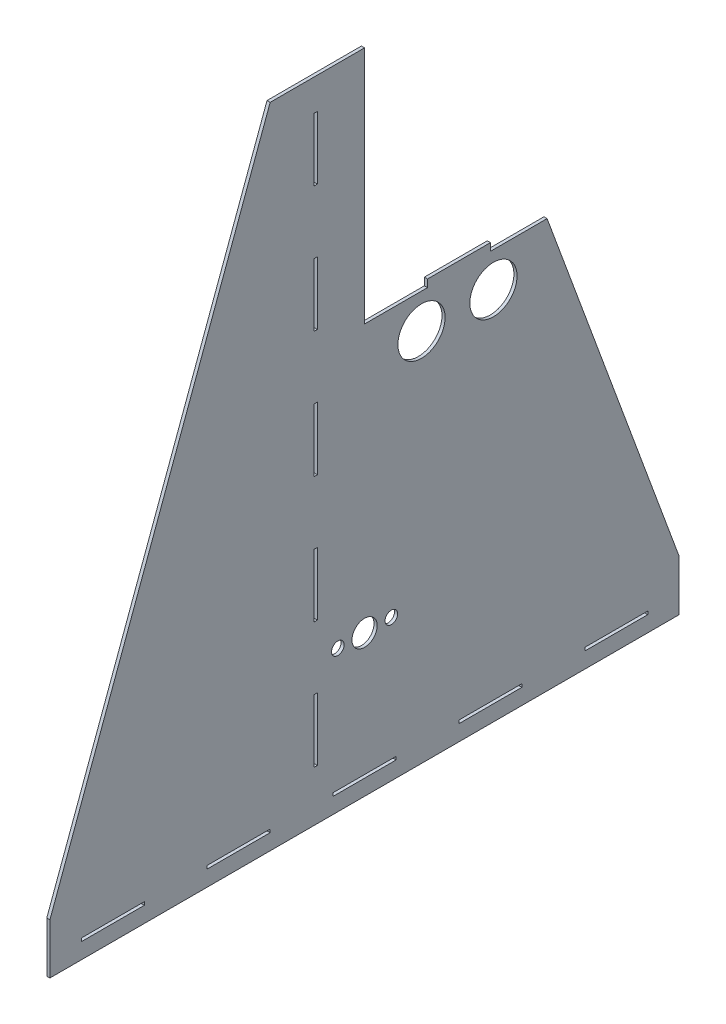
from build123d import *

# Parameters (mm, degrees)
SKICA1_R                = 4
SKICA1_W                = 20
SKICA1_H                = 1
SKICA1_W_2              = 1
SKICA1_H_2              = 20
SKICA1_R_2              = 2
SKICA1_R_3              = 7.5
P_IDAT_VYSUNUT_M1_DEPTH = 1


with BuildPart() as part:
    # Skica1 → Přidat vysunutím1 (new body)
    with BuildSketch(Plane(origin=(0, 0, 0), x_dir=(0, 0, -1), z_dir=(1, 0, 0))):
        Polygon((-100, 0), (100, 0), (100, 16), (58, 130), (40, 130), (40, 132.390761593), (20, 132.390761593), (20, 130), (0, 130), (0, 206), (-30, 206), (-100, 16), align=None)
        with Locations((0, 45)):
            Circle(SKICA1_R, mode=Mode.SUBTRACT)
        with Locations((0, 5.5)):
            Rectangle(SKICA1_W, SKICA1_H, mode=Mode.SUBTRACT)
        with Locations((-80, 5.5)):
            Rectangle(SKICA1_W, SKICA1_H, mode=Mode.SUBTRACT)
        with Locations((-40, 5.5)):
            Rectangle(SKICA1_W, SKICA1_H, mode=Mode.SUBTRACT)
        with Locations((-15.5, 26)):
            Rectangle(SKICA1_W_2, SKICA1_H_2, mode=Mode.SUBTRACT)
        with Locations((-8.5, 45)):
            Circle(SKICA1_R_2, mode=Mode.SUBTRACT)
        with Locations((-15.5, 66)):
            Rectangle(SKICA1_W_2, SKICA1_H_2, mode=Mode.SUBTRACT)
        with Locations((-15.5, 106)):
            Rectangle(SKICA1_W_2, SKICA1_H_2, mode=Mode.SUBTRACT)
        with Locations((-15.5, 146)):
            Rectangle(SKICA1_W_2, SKICA1_H_2, mode=Mode.SUBTRACT)
        with Locations((-15.5, 186)):
            Rectangle(SKICA1_W_2, SKICA1_H_2, mode=Mode.SUBTRACT)
        with Locations((80, 5.5)):
            Rectangle(SKICA1_W, SKICA1_H, mode=Mode.SUBTRACT)
        with Locations((18.09225545, 119)):
            Circle(SKICA1_R_3, mode=Mode.SUBTRACT)
        with Locations((40.95225545, 119)):
            Circle(SKICA1_R_3, mode=Mode.SUBTRACT)
        with Locations((40, 5.5)):
            Rectangle(SKICA1_W, SKICA1_H, mode=Mode.SUBTRACT)
        with Locations((8.5, 45)):
            Circle(SKICA1_R_2, mode=Mode.SUBTRACT)
    extrude(amount=P_IDAT_VYSUNUT_M1_DEPTH)


solid = part.part
